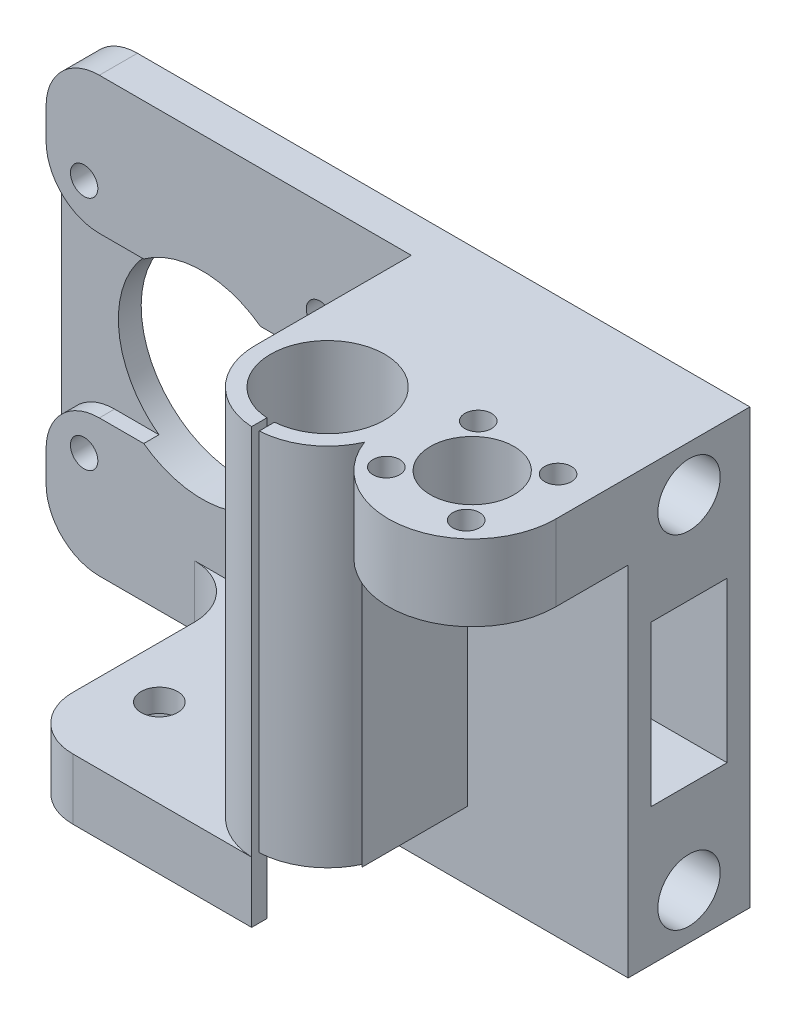
from build123d import *

# Parameters (mm, degrees)
SKETCH2_R             = 1.75
SKETCH2_R_2           = 5.5
BOSS_EXTRUDE1_DEPTH   = 28.5
CUT_EXTRUDE1_START    = 16
CUT_EXTRUDE1_DEPTH    = 83.998737366
SKETCH4_R             = 1.8
SKETCH4_R_2           = 13
HOLES_FOR_MOTOR_DEPTH = 99.998737366
BOSS_EXTRUDE2_START   = -20.5
BOSS_EXTRUDE2_DEPTH   = 8
SKETCH6_W             = 10
SKETCH6_H             = 21
CUT_EXTRUDE3_DEPTH    = 99.998737366
M4_CLEARANCE_HOLE1_D  = 4.8
CUT_EXTRUDE6_START    = -3
CUT_EXTRUDE6_DEPTH    = 3.4
FILLET1_R             = 7
SKETCH11_R            = 4.1
CUT_EXTRUDE7_DEPTH    = 30


with BuildPart() as part:
    # Sketch2 → Boss-Extrude1 (new, symmetric)
    with BuildSketch(Plane(origin=(0, 0, 0), x_dir=(1, 0, 0), z_dir=(0, 1, 0))):
        with BuildLine():
            Line((87.5, 0), (0, 0))
            Line((0, 0), (0, -5))
            Line((0, -5), (48, -5))
            Line((48, -5), (48, -25.5))
            ThreePointArc((48, -25.5), (50.607975624, -32.038348415), (57, -34.986832981))
            Line((57, -34.986832981), (57, -32.983314774))
            ThreePointArc((57, -32.983314774), (57.5, -18), (58, -32.983314774))
            Line((58, -32.983314774), (58, -34.986832981))
            ThreePointArc((58, -34.986832981), (62.894319797, -33.319930558), (66.190789474, -29.336688458))
            ThreePointArc((66.190789474, -29.336688458), (78.449190115, -36.325925267), (87.5, -25.5))
            Line((87.5, -25.5), (87.5, 0))
        make_face()
        with Locations((70.462323358, -30.748472232)):
            Circle(SKETCH2_R, mode=Mode.SUBTRACT)
        with Locations((81.748472232, -31.537676642)):
            Circle(SKETCH2_R, mode=Mode.SUBTRACT)
        with Locations((76.5, -25.5)):
            Circle(SKETCH2_R_2, mode=Mode.SUBTRACT)
        with Locations((71.251527768, -19.462323358)):
            Circle(SKETCH2_R, mode=Mode.SUBTRACT)
        with Locations((82.537676642, -20.251527768)):
            Circle(SKETCH2_R, mode=Mode.SUBTRACT)
    extrude(amount=BOSS_EXTRUDE1_DEPTH, both=True)

    # Sketch3 → Cut-Extrude1 (cut, through all)
    with BuildSketch(Plane.XY.offset(CUT_EXTRUDE1_START)):
        Polygon((66.4, 18.5), (88, 18.5), (88, -28.5), (57.1, -28.5), (57.1, -19.5), (66.4, -19.5), align=None)
    extrude(amount=CUT_EXTRUDE1_DEPTH, mode=Mode.SUBTRACT)

    # Sketch4 → Holes-for-motor (cut, through all)
    with BuildSketch(Plane.XY):
        with Locations((5, 15.5)):
            Circle(SKETCH4_R)
        with Locations((36, 15.5)):
            Circle(SKETCH4_R)
        with Locations((5, -15.5)):
            Circle(SKETCH4_R)
        with Locations((36, -15.5)):
            Circle(SKETCH4_R)
        with Locations((20.5, 0)):
            Circle(SKETCH4_R_2)
    extrude(amount=HOLES_FOR_MOTOR_DEPTH, mode=Mode.SUBTRACT)

    # Sketch5 → Boss-Extrude2 (add)
    with BuildSketch(Plane(origin=(0, 0, 0), x_dir=(1, 0, 0), z_dir=(0, 1, 0)).offset(BOSS_EXTRUDE2_START)):
        with BuildLine():
            Line((26.5, -4.986832981), (26.5, -34.986832981))
            Line((26.5, -34.986832981), (57, -34.986832981))
            ThreePointArc((57, -34.986832981), (50.607975624, -32.038348415), (48, -25.5))
            Line((48, -25.5), (48, -4.986832981))
            Line((48, -4.986832981), (26.5, -4.986832981))
        make_face()
    extrude(amount=-BOSS_EXTRUDE2_DEPTH)

    # Sketch6 → Cut-Extrude3 (cut, through all)
    with BuildSketch(Plane(origin=(0, 0, 0), x_dir=(0, 0, -1), z_dir=(1, 0, 0))):
        with Locations((-8, 0)):
            Rectangle(SKETCH6_W, SKETCH6_H)
    extrude(amount=CUT_EXTRUDE3_DEPTH, mode=Mode.SUBTRACT)

    # M4 Clearance Hole1 (through all)
    with Locations(Plane(origin=(0, -20.5, 0), x_dir=(1, 0, 0), z_dir=(0, 1, 0))):
        with Locations((33.28379107, -23.399836079)):
            Hole(M4_CLEARANCE_HOLE1_D / 2)

    # Sketch10 → Cut-Extrude6 (cut)
    with BuildSketch(Plane(origin=(0, -20.5, 0), x_dir=(1, 0, 0), z_dir=(0, 1, 0)).offset(CUT_EXTRUDE6_START)):
        Polygon((39.840713008, -23.399836079), (37.762252039, -19.799836079), (22.762252039, -19.799836079), (22.762252039, -26.999836079), (37.762252039, -26.999836079), align=None)
    extrude(amount=-CUT_EXTRUDE6_DEPTH, mode=Mode.SUBTRACT)

    # Fillet1
    fillet1_edges = [part.edges().sort_by_distance(p)[0] for p in [
        (0, -28.5, 2.5),
        (0, 28.5, 2.5),
        (26.5, -24.5, 34.986832981),
        (0, 10.5, 4),
        (0, -10.5, 4),
        (26.5, -24.5, 5),
    ]]
    fillet(fillet1_edges, radius=FILLET1_R)

    # Sketch11 → Cut-Extrude7 (cut)
    with BuildSketch(Plane(origin=(87.5, 0, 0), x_dir=(0, 0, -1), z_dir=(1, 0, 0))):
        with Locations((-8, -22.5)):
            Circle(SKETCH11_R)
        with Locations((-8, 22.5)):
            Circle(SKETCH11_R)
    extrude(amount=-CUT_EXTRUDE7_DEPTH, mode=Mode.SUBTRACT)


solid = part.part
